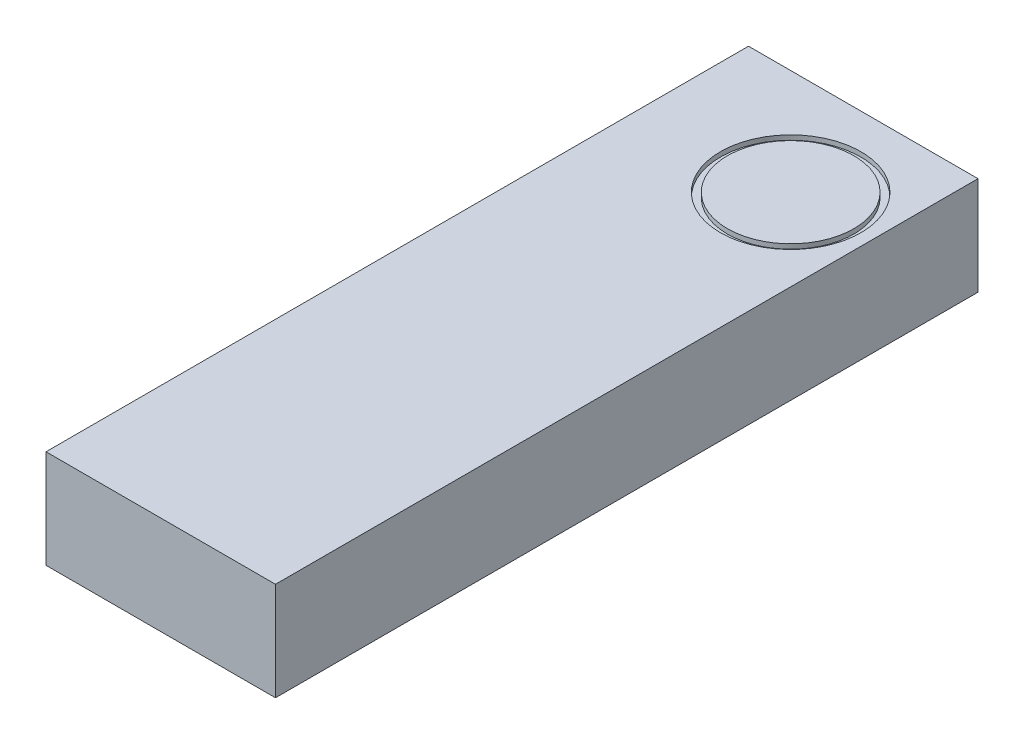
from build123d import *

# Parameters (mm, degrees)
ESBO_O1_W                = 98
ESBO_O1_H                = 300
RESSALTO_EXTRUS_O1_DEPTH = 42
ESBO_O2_R                = 30
ESBO_O2_R_2              = 27
CORTE_EXTRUS_O1_DEPTH    = 2


with BuildPart() as part:
    # Esboço1 → Ressalto-extrusão1 (new body)
    with BuildSketch(Plane(origin=(0, 0, 0), x_dir=(1, 0, 0), z_dir=(0, 1, 0))):
        Rectangle(ESBO_O1_W, ESBO_O1_H)
    extrude(amount=RESSALTO_EXTRUS_O1_DEPTH)

    # Esboço2 → Corte-extrusão1 (cut)
    with BuildSketch(Plane(origin=(0, 42, 0), x_dir=(1, 0, 0), z_dir=(0, 1, 0))):
        with Locations((14, 105)):
            Circle(ESBO_O2_R)
        with Locations((14, 105)):
            Circle(ESBO_O2_R_2, mode=Mode.SUBTRACT)
    extrude(amount=-CORTE_EXTRUS_O1_DEPTH, mode=Mode.SUBTRACT)


solid = part.part
